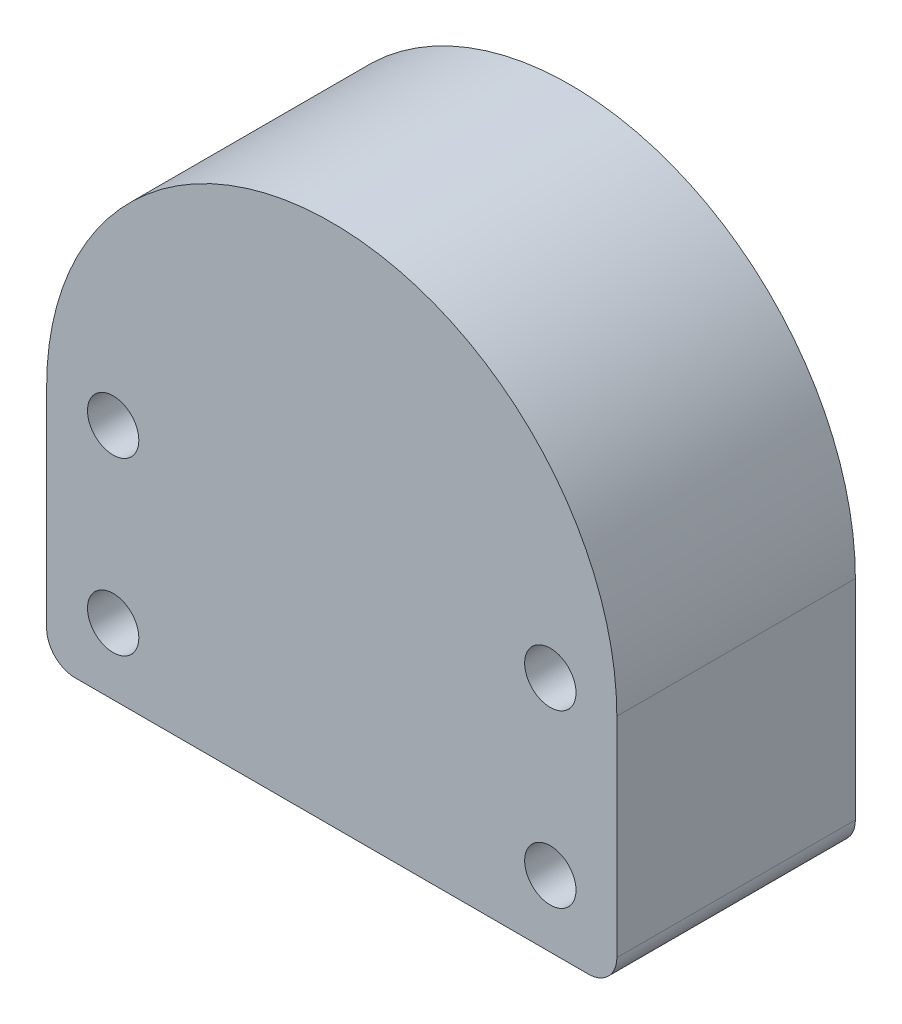
from build123d import *

# Parameters (mm, degrees)
BOSS_EXTRUDE1_DEPTH  = 25.1
M5_CLEARANCE_HOLE1_D = 5.4
FILLET1_R            = 3


with BuildPart() as part:
    # Sketch1 → Boss-Extrude1 (new body)
    with BuildSketch(Plane.XY):
        with BuildLine():
            Line((38.905545776, 72), (38.905545776, 47))
            Line((38.905545776, 47), (-21.094454223, 47))
            Line((-21.094454223, 47), (-21.094454223, 72))
            ThreePointArc((-21.094454223, 72), (8.905545776, 101.999999999), (38.905545776, 72))
        make_face()
    extrude(amount=BOSS_EXTRUDE1_DEPTH)

    # M5 Clearance Hole1 (through all)
    with Locations(Plane(origin=(0, 0, 25.1), x_dir=(-1, 0, 0), z_dir=(0, 0, 1))):
        with Locations((-31.905545776, -72), (-31.905545776, -54), (14.094454224, -54), (14.094454224, -72)):
            Hole(M5_CLEARANCE_HOLE1_D / 2)

    # Fillet1
    fillet1_edges = [part.edges().sort_by_distance(p)[0] for p in [
        (38.905545776, 47, 12.55),
        (-21.094454223, 47, 12.55),
    ]]
    fillet(fillet1_edges, radius=FILLET1_R)


solid = part.part
